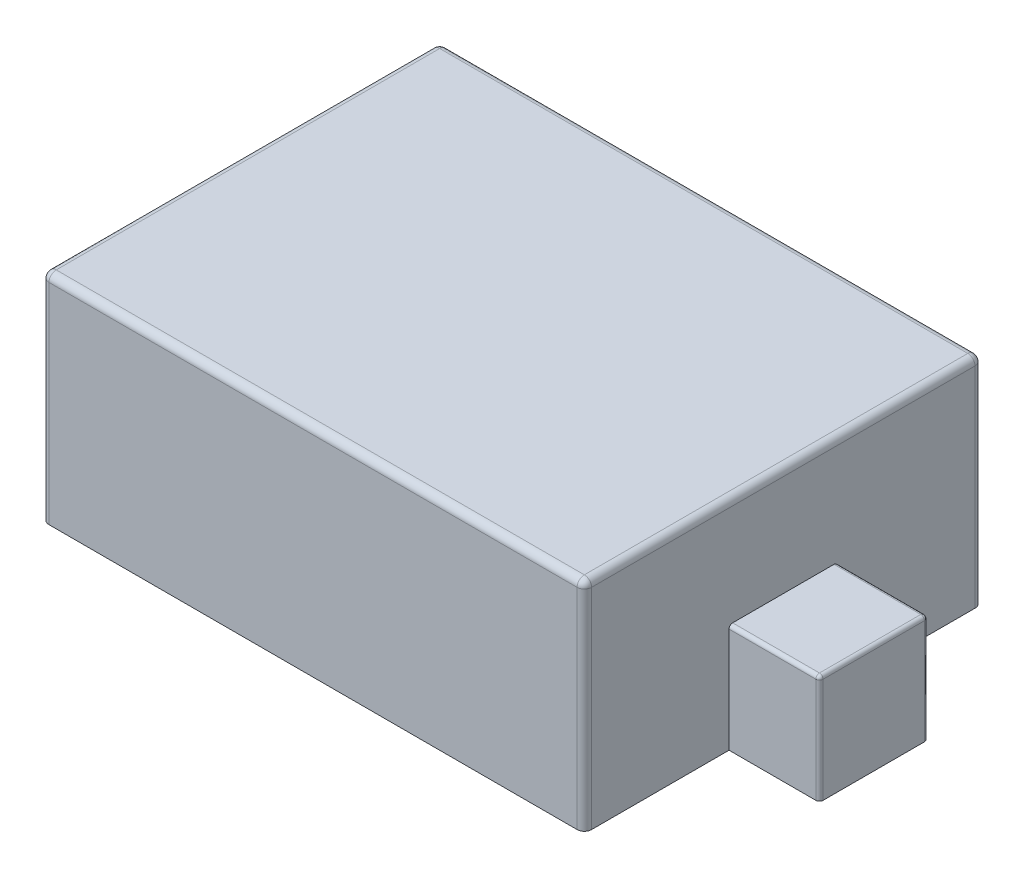
from build123d import *

# Parameters (mm, degrees)
BOSS_EXTRUDE1_DEPTH = 0.3
FILLET1_R           = 0.02
SKETCH2_W           = 0.25
SKETCH2_H           = 0.3
BOSS_EXTRUDE2_DEPTH = 0.3
FILLET2_R           = 0.01


with BuildPart() as part:
    # Sketch1 → Boss-Extrude1 (new, symmetric)
    with BuildSketch(Plane(origin=(0, 0, 0), x_dir=(1, 0, 0), z_dir=(0, 1, 0))):
        with BuildLine():
            Line((-0.73, -0.55), (0.73, -0.55))
            ThreePointArc((0.73, -0.55), (0.744142136, -0.544142136), (0.75, -0.53))
            Line((0.75, -0.53), (0.75, 0.53))
            ThreePointArc((0.75, 0.53), (0.744142136, 0.544142136), (0.73, 0.55))
            Line((0.73, 0.55), (-0.73, 0.55))
            ThreePointArc((-0.73, 0.55), (-0.744142136, 0.544142136), (-0.75, 0.53))
            Line((-0.75, 0.53), (-0.75, -0.53))
            ThreePointArc((-0.75, -0.53), (-0.744142136, -0.544142136), (-0.73, -0.55))
        make_face()
    extrude(amount=BOSS_EXTRUDE1_DEPTH, both=True)

    # Fillet1
    fillet1_edges = [part.edges().sort_by_distance(p)[0] for p in [
        (-0.744142136, 0.3, 0.544142136),
        (-0.75, 0.3, 0),
        (-0.744142136, 0.3, -0.544142136),
        (0, 0.3, -0.55),
        (0.744142136, 0.3, -0.544142136),
        (0.744142136, 0.3, 0.544142136),
        (0.75, 0.3, 0),
        (0, 0.3, 0.55),
    ]]
    fillet(fillet1_edges, radius=FILLET1_R)

    # Sketch2 → Boss-Extrude2 (add)
    with BuildSketch(Plane.XZ.offset(0.3)):
        with Locations((-0.875, 0)):
            Rectangle(SKETCH2_W, SKETCH2_H)
        with Locations((0.875, 0)):
            Rectangle(SKETCH2_W, SKETCH2_H)
    extrude(amount=-BOSS_EXTRUDE2_DEPTH)

    # Fillet2
    fillet2_edges = [part.edges().sort_by_distance(p)[0] for p in [
        (-1, -0.15, -0.15),
        (-0.875, 0, -0.15),
        (-1, 0, 0),
        (-0.875, 0, 0.15),
        (-1, -0.15, 0.15),
        (1, -0.15, -0.15),
        (1, -0.15, 0.15),
        (0.875, 0, -0.15),
        (1, 0, 0),
        (0.875, 0, 0.15),
    ]]
    fillet(fillet2_edges, radius=FILLET2_R)


solid = part.part
